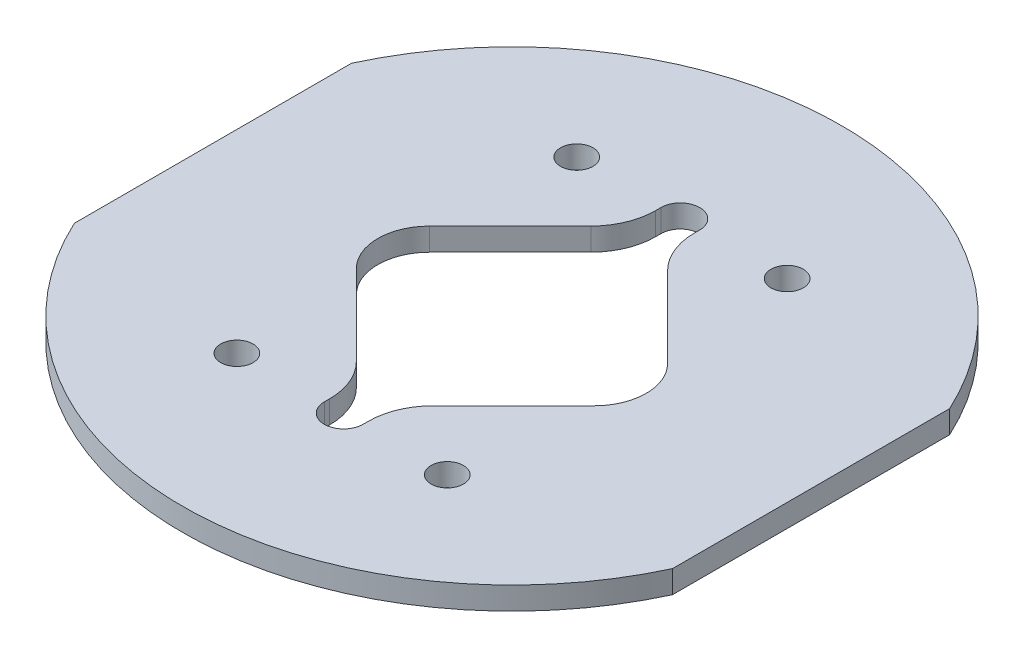
from build123d import *

# Parameters (mm, degrees)
BOSS_EXTRUDE1_DEPTH = 1.75
CUT_EXTRUDE1_DEPTH  = 35.422145488
CUT_EXTRUDE2_DEPTH  = 1.75
FILLET2_R           = 5
FILLET1_R           = 4
SKETCH6_R           = 1.25
CUT_EXTRUDE3_DEPTH  = 35.422145488
CIRPATTERN3_COUNT   = 2


with BuildPart() as part:
    # Sketch1 → Boss-Extrude1 (new body)
    with BuildSketch(Plane(origin=(0, 0, 0), x_dir=(1, 0, 0), z_dir=(0, 1, 0))):
        with BuildLine():
            Line((-23.1, -10.705213683), (-23.1, 10.705213683))
            ThreePointArc((-23.1, 10.705213683), (0, 25.46), (23.1, 10.705213683))
            Line((23.1, 10.705213683), (23.1, -10.705213683))
            ThreePointArc((23.1, -10.705213683), (0, -25.46), (-23.1, -10.705213683))
        make_face()
    extrude(amount=BOSS_EXTRUDE1_DEPTH)

    # Sketch3 → Cut-Extrude1 (cut, through all)
    with BuildSketch(Plane(origin=(0, 1.75, 0), x_dir=(1, 0, 0), z_dir=(0, 1, 0))):
        Polygon((0, -12.02081528), (-12.02081528, 0), (0, 12.02081528), (12.02081528, 0), align=None)
    extrude(amount=-CUT_EXTRUDE1_DEPTH, mode=Mode.SUBTRACT)

    # Sketch4 → Cut-Extrude2 (cut)
    with BuildSketch(Plane(origin=(0, 1.75, 0), x_dir=(1, 0, 0), z_dir=(0, 1, 0))):
        with BuildLine():
            Line((-1.5, 13), (-1.5, -13))
            ThreePointArc((-1.5, -13), (0, -14.5), (1.5, -13))
            Line((1.5, -13), (1.5, 13))
            ThreePointArc((1.5, 13), (0, 14.5), (-1.5, 13))
        make_face()
    extrude(amount=-CUT_EXTRUDE2_DEPTH, mode=Mode.SUBTRACT)

    # Fillet2
    fillet2_edges = [part.edges().sort_by_distance(p)[0] for p in [
        (1.5, 0.875, -10.52081528),
        (-1.5, 0.875, -10.52081528),
        (-1.5, 0.875, 10.52081528),
        (1.5, 0.875, 10.52081528),
    ]]
    fillet(fillet2_edges, radius=FILLET2_R)

    # Fillet1
    fillet1_edges = [part.edges().sort_by_distance(p)[0] for p in [
        (12.02081528, 0.875, 0),
        (-12.02081528, 0.875, 0),
    ]]
    fillet(fillet1_edges, radius=FILLET1_R)

    # Sketch6 → Cut-Extrude3 (cut, through all)
    with BuildSketch(Plane(origin=(0, 1.75, 0), x_dir=(1, 0, 0), z_dir=(0, 1, 0))):
        with Locations((-8.125, 13.125)):
            Circle(SKETCH6_R)
        with Locations((8.125, 13.125)):
            Circle(SKETCH6_R)
    cut_extrude3 = extrude(amount=-CUT_EXTRUDE3_DEPTH, mode=Mode.SUBTRACT)

    # CirPattern3: Cut-Extrude3 ×2 about axis
    cirpattern3_axis = Axis((0, 0, 0), (0, 1, 0))
    for i in range(1, CIRPATTERN3_COUNT):
        add(cut_extrude3.rotate(cirpattern3_axis, i * 360 / CIRPATTERN3_COUNT), mode=Mode.SUBTRACT)


solid = part.part
